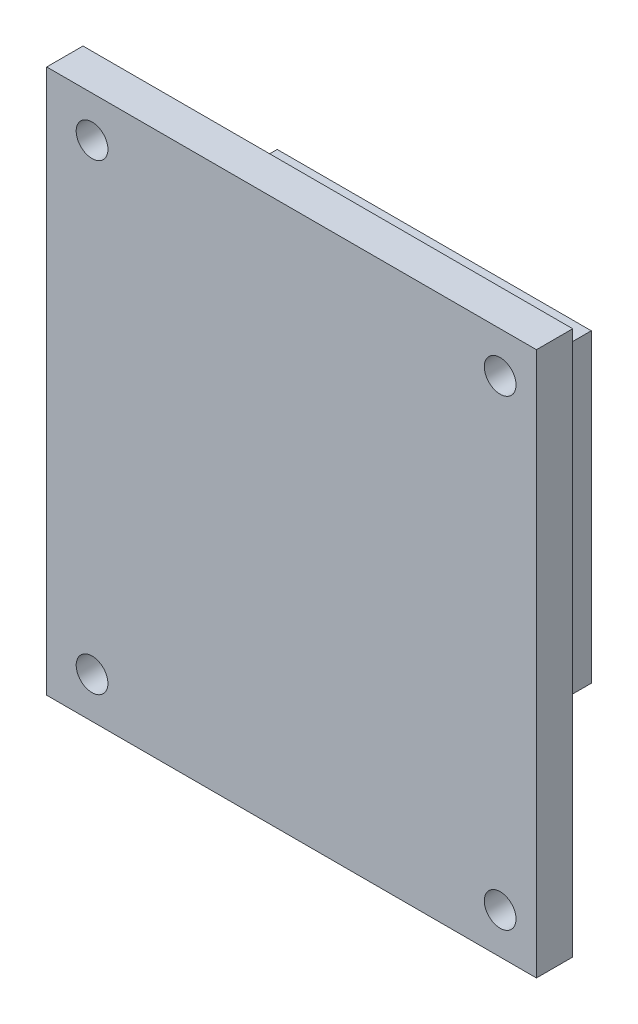
from build123d import *

# Parameters (mm, degrees)
ESQUISSE1_W             = 54
ESQUISSE1_H             = 60
ESQUISSE1_R             = 1.75
BOSS_EXTRU_1_DEPTH      = 4
ESQUISSE2_W             = 34.632966594
ESQUISSE2_H             = 18
BOSS_EXTRU_3_DEPTH      = 14
ESQUISSE3_W             = 10
ESQUISSE3_H             = 10
ENL_V_MAT_EXTRU_3_DEPTH = 75.592749346
ESQUISSE4_R             = 2
ENL_V_MAT_EXTRU_4_DEPTH = 42


with BuildPart() as part:
    # Esquisse1 → Boss.-Extru.1 (new body)
    with BuildSketch(Plane.XY):
        with Locations((27, -30)):
            Rectangle(ESQUISSE1_W, ESQUISSE1_H)
        with Locations((5, -55.5)):
            Circle(ESQUISSE1_R, mode=Mode.SUBTRACT)
        with Locations((50, -55.5)):
            Circle(ESQUISSE1_R, mode=Mode.SUBTRACT)
        with Locations((5, -4.5)):
            Circle(ESQUISSE1_R, mode=Mode.SUBTRACT)
        with Locations((50, -4.5)):
            Circle(ESQUISSE1_R, mode=Mode.SUBTRACT)
    extrude(amount=BOSS_EXTRU_1_DEPTH)

    # Esquisse2 → Boss.-Extru.3 (add)
    with BuildSketch(Plane(origin=(0, 0, 0), x_dir=(-1, 0, 0), z_dir=(0, 0, -1))):
        with Locations((-24.732039329, -37.831611037)):
            Rectangle(ESQUISSE2_W, ESQUISSE2_H)
    boss_extru_3 = extrude(amount=BOSS_EXTRU_3_DEPTH)

    # Esquisse3 → Enlèv. mat.-Extru.3 (cut, through all)
    with BuildSketch(Plane(origin=(42.048522626, 0, 0), x_dir=(0, 0, -1), z_dir=(1, 0, 0))):
        with Locations((5, -37.831611037)):
            Rectangle(ESQUISSE3_W, ESQUISSE3_H)
    enl_v_mat_extru_3 = extrude(amount=-ENL_V_MAT_EXTRU_3_DEPTH, mode=Mode.SUBTRACT)

    # Symétrie1: Boss.-Extru.3, Enlèv. mat.-Extru.3 across plane
    add(boss_extru_3.mirror(Plane(origin=(0, -30, 0), x_dir=(0, 0, 1), z_dir=(0, -1, 0))))
    add(enl_v_mat_extru_3.mirror(Plane(origin=(0, -30, 0), x_dir=(0, 0, 1), z_dir=(0, -1, 0))), mode=Mode.SUBTRACT)

    # Esquisse4 → Enlèv. mat.-Extru.4 (cut)
    with BuildSketch(Plane.XZ.offset(46.831611037)):
        with Locations((11.427545967, -10)):
            Circle(ESQUISSE4_R)
    extrude(amount=-ENL_V_MAT_EXTRU_4_DEPTH, mode=Mode.SUBTRACT)


solid = part.part
